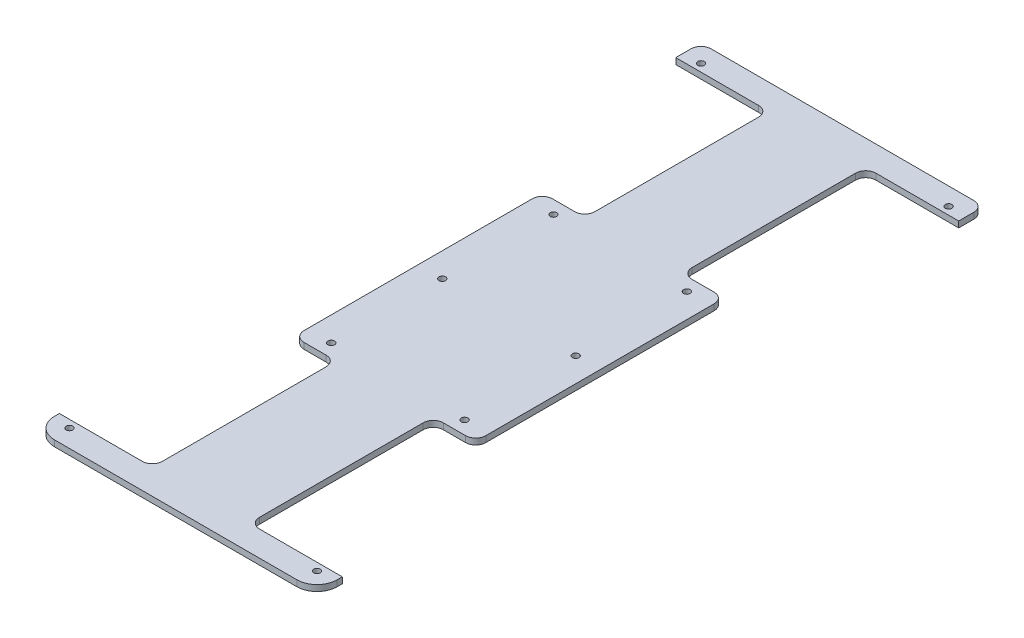
from build123d import *

# Parameters (mm, degrees)
BOSS_EXTRUDE1_DEPTH = 3
FILLET1_R           = 10
FILLET2_R           = 5
SKETCH2_R           = 1.65
CUT_EXTRUDE1_DEPTH  = 359.481519747
SKETCH3_R           = 1.65
CUT_EXTRUDE2_DEPTH  = 359.481519747
SKETCH4_R           = 1.65
CUT_EXTRUDE3_DEPTH  = 359.481519747
FILLET3_R           = 5


with BuildPart() as part:
    # Sketch1 → Boss-Extrude1 (new body)
    with BuildSketch(Plane(origin=(0, 0, 0), x_dir=(1, 0, 0), z_dir=(0, 1, 0))):
        Polygon((0, 0), (140, 0), (140, 12.5), (94, 12.5), (94, 103.5), (115, 103.5), (115, 226.5), (94, 226.5), (94, 317.5), (140, 317.5), (140, 330), (0, 330), (0, 317.5), (46, 317.5), (46, 226.5), (25, 226.5), (25, 103.5), (46, 103.5), (46, 12.5), (0, 12.5), align=None)
    extrude(amount=BOSS_EXTRUDE1_DEPTH)

    # Fillet1
    fillet1_edges = [part.edges().sort_by_distance(p)[0] for p in [
        (140, 1.5, 0),
        (0, 1.5, 0),
    ]]
    fillet(fillet1_edges, radius=FILLET1_R)

    # Fillet2
    fillet2_edges = [part.edges().sort_by_distance(p)[0] for p in [
        (0, 1.5, -330),
        (140, 1.5, -330),
        (115, 1.5, -226.5),
        (115, 1.5, -103.5),
        (25, 1.5, -103.5),
        (25, 1.5, -226.5),
    ]]
    fillet(fillet2_edges, radius=FILLET2_R)

    # Sketch2 → Cut-Extrude1 (cut, through all)
    with BuildSketch(Plane(origin=(0, 3, 0), x_dir=(1, 0, 0), z_dir=(0, 1, 0))):
        with Locations((37, 220)):
            Circle(SKETCH2_R)
        with Locations((37, 165)):
            Circle(SKETCH2_R)
        with Locations((37, 110)):
            Circle(SKETCH2_R)
        with Locations((103, 110)):
            Circle(SKETCH2_R)
        with Locations((103, 165)):
            Circle(SKETCH2_R)
        with Locations((103, 220)):
            Circle(SKETCH2_R)
    extrude(amount=-CUT_EXTRUDE1_DEPTH, mode=Mode.SUBTRACT)

    # Sketch3 → Cut-Extrude2 (cut, through all)
    with BuildSketch(Plane(origin=(0, 3, 0), x_dir=(1, 0, 0), z_dir=(0, 1, 0))):
        with Locations((8.75, 8.75)):
            Circle(SKETCH3_R)
        with Locations((131.25, 8.75)):
            Circle(SKETCH3_R)
    extrude(amount=-CUT_EXTRUDE2_DEPTH, mode=Mode.SUBTRACT)

    # Sketch4 → Cut-Extrude3 (cut, through all)
    with BuildSketch(Plane(origin=(0, 3, 0), x_dir=(1, 0, 0), z_dir=(0, 1, 0))):
        with Locations((8.75, 321.25)):
            Circle(SKETCH4_R)
        with Locations((131.25, 321.25)):
            Circle(SKETCH4_R)
    extrude(amount=-CUT_EXTRUDE3_DEPTH, mode=Mode.SUBTRACT)

    # Fillet3
    fillet3_edges = [part.edges().sort_by_distance(p)[0] for p in [
        (94, 1.5, -226.5),
        (46, 1.5, -226.5),
        (94, 1.5, -103.5),
        (46, 1.5, -103.5),
        (46, 1.5, -12.5),
        (94, 1.5, -12.5),
        (46, 1.5, -317.5),
        (94, 1.5, -317.5),
    ]]
    fillet(fillet3_edges, radius=FILLET3_R)


solid = part.part
